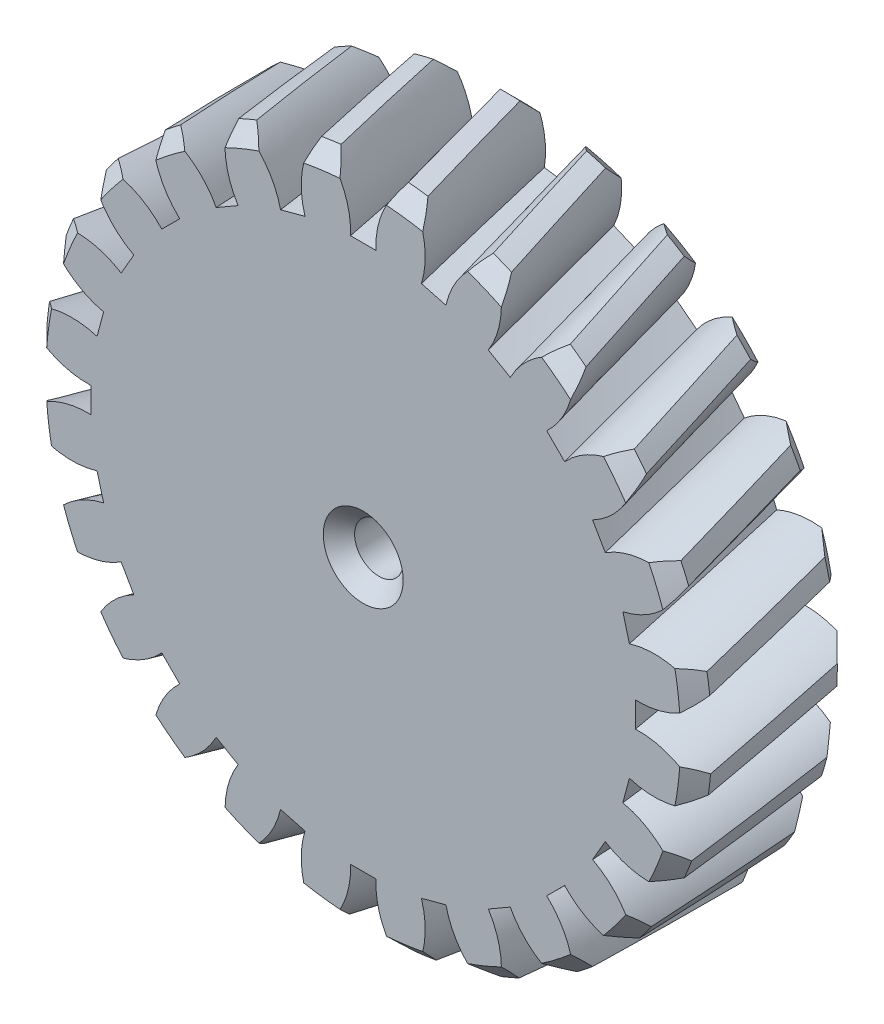
from build123d import *

# Parameters (mm, degrees)
SKETCH5_R           = 21.25
SKETCH5_R_2         = 1.55
BOSS_EXTRUDE1_DEPTH = 10
CUT_EXTRUDE1_DEPTH  = 3
FILLET1_R           = 1
CHAMFER1_SIZE       = 1
CUT_SWEEP1_PITCH    = 500
CIRPATTERN1_COUNT   = 24


with BuildPart() as part:
    # Sketch5 → Boss-Extrude1 (new body)
    with BuildSketch(Plane(origin=(0, 0, 0), x_dir=(0, 1, 0), z_dir=(0, 0, 1))):
        with Locations(Location((0, 0, 0), (0, 0, 270))):
            Circle(SKETCH5_R)
        with Locations(Location((0, 0, 0), (0, 0, 270))):
            Circle(SKETCH5_R_2, mode=Mode.SUBTRACT)
    extrude(amount=BOSS_EXTRUDE1_DEPTH)

    # Sketch3 → Cut-Extrude1 (cut)
    with BuildSketch(Plane(origin=(0, 0, 0), x_dir=(0, 1, 0), z_dir=(0, 0, 1))):
        with BuildLine():
            Line((-3.692642461, 6.395844357), (-2.466521541, 13.812520629))
            ThreePointArc((-2.466521541, 13.812520629), (0, 15.904756618), (2.466521541, 13.812520629))
            Line((2.466521541, 13.812520629), (3.692642461, 6.395844357))
            Line((3.692642461, 6.395844357), (10.728732985, 9.042330628))
            ThreePointArc((10.728732985, 9.042330628), (13.773923273, 7.952378309), (13.195254525, 4.770190001))
            Line((13.195254525, 4.770190001), (7.385284922, 0))
            Line((7.385284922, 0), (13.195254525, -4.770190001))
            ThreePointArc((13.195254525, -4.770190001), (13.773923273, -7.952378309), (10.728732985, -9.042330628))
            Line((10.728732985, -9.042330628), (3.692642461, -6.395844357))
            Line((3.692642461, -6.395844357), (2.466521541, -13.812520629))
            ThreePointArc((2.466521541, -13.812520629), (0, -15.904756618), (-2.466521541, -13.812520629))
            Line((-2.466521541, -13.812520629), (-3.692642461, -6.395844357))
            Line((-3.692642461, -6.395844357), (-10.728732985, -9.042330628))
            ThreePointArc((-10.728732985, -9.042330628), (-13.773923273, -7.952378309), (-13.195254525, -4.770190001))
            Line((-13.195254525, -4.770190001), (-7.385284922, 0))
            Line((-7.385284922, 0), (-13.195254525, 4.770190001))
            ThreePointArc((-13.195254525, 4.770190001), (-13.773923273, 7.952378309), (-10.728732985, 9.042330628))
            Line((-10.728732985, 9.042330628), (-3.692642461, 6.395844357))
        make_face()
    extrude(amount=CUT_EXTRUDE1_DEPTH, mode=Mode.SUBTRACT)

    # Fillet1
    fillet1_edges = [part.edges().sort_by_distance(p)[0] for p in [
        (-15.904756618, 0, 0),
        (-10.104182493, -3.079582001, 0),
        (-7.719087492, -7.210687723, 0),
        (-7.952378309, -13.773923273, 0),
        (-2.385095001, -10.290269724, 0),
        (2.385095001, -10.290269724, 0),
        (7.952378309, -13.773923273, 0),
        (7.719087492, -7.210687723, 0),
        (10.104182493, -3.079582001, 0),
        (15.904756618, 0, 0),
        (10.104182493, 3.079582001, 0),
        (7.719087492, 7.210687723, 0),
        (7.952378309, 13.773923273, 0),
        (2.385095001, 10.290269724, 0),
        (-2.385095001, 10.290269724, 0),
        (-7.952378309, 13.773923273, 0),
        (-7.719087492, 7.210687723, 0),
        (-10.104182493, 3.079582001, 0),
    ]]
    fillet(fillet1_edges, radius=FILLET1_R)

    # Chamfer1
    chamfer1_edges = [part.edges().sort_by_distance(p)[0] for p in [
        (-21.25, 0, 0),
        (-21.25, 0, 10),
        (-1.55, 0, 10),
    ]]
    chamfer(chamfer1_edges, length=CHAMFER1_SIZE)

    # Cut-Sweep1: the profile of Sketch10 screwed along a left-hand helix of 0.04 turns, 58 arcs to a turn; built about Z, then put on its axis
    cut_sweep1_z = Axis((0, 0, 0), (0, 0, 1))
    cut_sweep1_corners = [(-17.367955513, 0.8085, 0), (-17.367955513, -0.8085, 0), (-21.140955513, -2.15, 0), (-21.140955513, 2.15, 0)]
    with BuildLine(mode=Mode.PRIVATE) as cut_sweep1_profile:
        Line(cut_sweep1_corners[0], cut_sweep1_corners[1])
        ThreePointArc((-17.367955513, -0.8085, 0), (-19.383657961, -1.115865105, 0), (-21.140955513, -2.15, 0))
        ThreePointArc((-21.140955513, -2.15, 0), (-21.25, 0, 0), (-21.140955513, 2.15, 0))
        ThreePointArc((-21.140955513, 2.15, 0), (-19.383657961, 1.115865105, 0), (-17.367955513, 0.8085, 0))
    cut_sweep1_cap = Face(cut_sweep1_profile.wire())
    cut_sweep1_arcs = [((-17.367955513, -0.8085, 0), (-19.522817706, -0.72447508, 0), (-21.140955513, -2.15, 0), (1, 0.9284470026767502, 1)), ((-21.140955513, -2.15, 0), (-21.359606936, 0, 0), (-21.140955513, 2.15, 0), (1, 0.9948684947264679, 1)), ((-21.140955513, 2.15, 0), (-19.522817706, 0.72447508, 0), (-17.367955513, 0.8085, 0), (1, 0.9284470026767497, 1))]  # start, shoulder, end, weights
    cut_sweep1_turn_angles = [0, -3.103448276, -6.206896552, -9.310344828, -12.413793103, -13.406896552, -14.4]
    cut_sweep1_turn_weights = [1, 0.9985334138511238, 1, 0.9985334138511238, 1, 0.9998497886164538, 1]
    cut_sweep1_turn_rails = [Edge.make_bspline([Vector(p[0], p[1], 0).rotate(cut_sweep1_z, cut_sweep1_turn_angles[k]) / cut_sweep1_turn_weights[k] + Vector(0, 0, p[2] + -CUT_SWEEP1_PITCH * cut_sweep1_turn_angles[k] / 360) for k in range(7)], [0, 0, 0, 1, 1, 2, 2, 3, 3, 3], 2, cut_sweep1_turn_weights) for p in cut_sweep1_corners]
    cut_sweep1_turn_sides = [*[Face.make_surface_from_curves(cut_sweep1_turn_rails[p[0]], cut_sweep1_turn_rails[p[1]]) for p in [(0, 1)]], *[Face.make_bezier_surface([[Vector(p[j][0], p[j][1], 0).rotate(cut_sweep1_z, cut_sweep1_turn_angles[2 * i + k]) / cut_sweep1_turn_weights[2 * i + k] + Vector(0, 0, p[j][2] + -CUT_SWEEP1_PITCH * cut_sweep1_turn_angles[2 * i + k] / 360) for k in range(3)] for j in range(3)], [[p[3][j] * cut_sweep1_turn_weights[2 * i + k] for k in range(3)] for j in range(3)]) for p in cut_sweep1_arcs for i in range(3)]]
    cut_sweep1 = Plane(origin=(0, 0, 10), x_dir=(-1, 0, 0), z_dir=(0, 0, -1)) * Solid(Shell([*cut_sweep1_turn_sides, cut_sweep1_cap, cut_sweep1_cap.rotate(cut_sweep1_z, -14.4).moved(Location((0, 0, -CUT_SWEEP1_PITCH * -14.4 / 360)))]))
    add(cut_sweep1, mode=Mode.SUBTRACT)

    # CirPattern1: Cut-Sweep1 ×24 about axis
    cirpattern1_axis = Axis((0, 0, 10), (0, 0, -1))
    for i in range(1, CIRPATTERN1_COUNT):
        add(cut_sweep1.rotate(cirpattern1_axis, i * 360 / CIRPATTERN1_COUNT), mode=Mode.SUBTRACT)


solid = part.part
